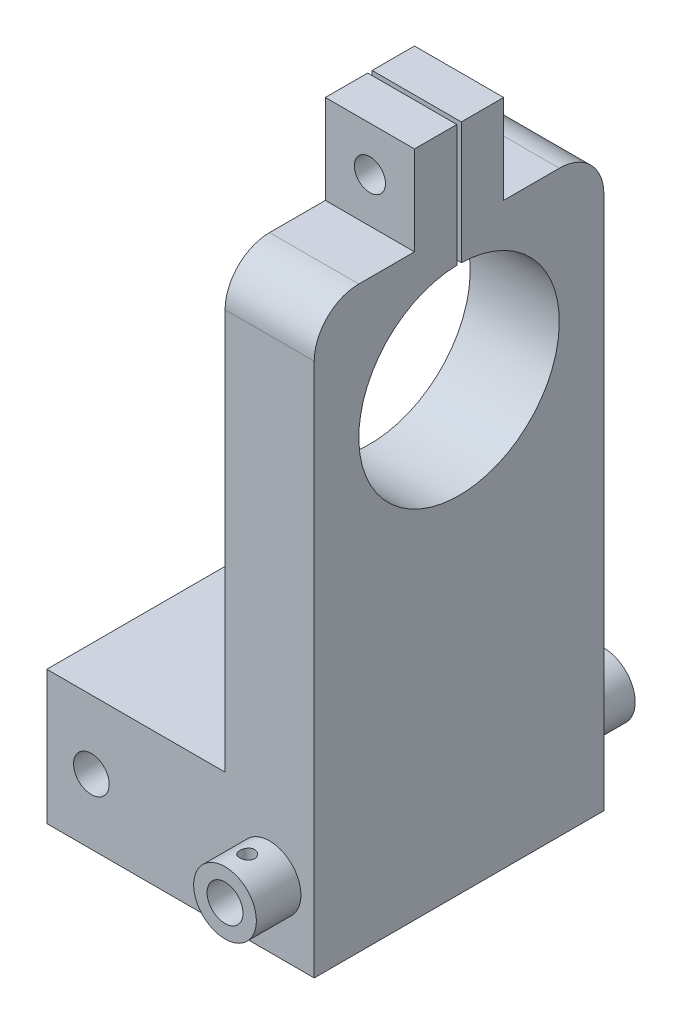
from build123d import *

# Parameters (mm, degrees)
CROQUIS1_R                                     = 22.5
SALIENTE_EXTRUIR1_DEPTH                        = 20
CROQUIS2_W                                     = 65
CROQUIS2_H                                     = 30
SALIENTE_EXTRUIR2_DEPTH                        = 40
CROQUIS4_W                                     = 1
CROQUIS4_H                                     = 60
CORTAR_EXTRUIR1_DEPTH                          = 40
TALADRO_DE_MARGEN_PARA_M61_D                   = 7
CROQUIS6_R                                     = 4
CORTAR_EXTRUIR2_DEPTH                          = 126.797456254
SALIENTE_EXTRUIR3_DEPTH                        = 10
SALIENTE_EXTRUIR3_DEPTH_BACK                   = 75
CROQUIS7_R                                     = 7.032700754
CROQUIS7_R_2                                   = 4.032700754
PERFORADOR_PARA_ROSCAR_PARA_MACHO_DE_ROS_D     = 3.3
PERFORADOR_PARA_ROSCAR_PARA_MACHO_DE_ROS_DEPTH = 5
PERFORADOR_PARA_ROSCAR_PARA_MACHO_DE_ROS_TIP   = 0.991420021
PERFORADOR_PARA_ROSCAR_PARA_MACHO_DE_2_D       = 3.3
PERFORADOR_PARA_ROSCAR_PARA_MACHO_DE_2_DEPTH   = 5
PERFORADOR_PARA_ROSCAR_PARA_MACHO_DE_2_TIP     = 0.991420021


with BuildPart() as part:
    # Croquis1 → Saliente-Extruir1 (new body)
    with BuildSketch(Plane(origin=(0, 0, 0), x_dir=(0, 0, -1), z_dir=(1, 0, 0))):
        with BuildLine():
            Line((-32.5, 0), (-32.5, -100))
            Line((-32.5, -100), (32.5, -100))
            Line((32.5, -100), (32.5, 0))
            Line((32.5, 0), (32.5, 19.863502686))
            ThreePointArc((32.5, 19.863502686), (29.571067812, 26.934570498), (22.5, 29.863502686))
            Line((22.5, 29.863502686), (10, 29.863502686))
            Line((10, 29.863502686), (10, 49.863502686))
            Line((10, 49.863502686), (-10, 49.863502686))
            Line((-10, 49.863502686), (-10, 29.863502686))
            Line((-10, 29.863502686), (-22.5, 29.863502686))
            ThreePointArc((-22.5, 29.863502686), (-29.571067812, 26.934570498), (-32.5, 19.863502686))
            Line((-32.5, 19.863502686), (-32.5, 0))
        make_face()
        Circle(CROQUIS1_R, mode=Mode.SUBTRACT)
    extrude(amount=SALIENTE_EXTRUIR1_DEPTH)

    # Croquis2 → Saliente-Extruir2 (add)
    with BuildSketch(Plane.ZY):
        with Locations((0, -85)):
            Rectangle(CROQUIS2_W, CROQUIS2_H)
    extrude(amount=SALIENTE_EXTRUIR2_DEPTH)

    # Croquis4 → Cortar-Extruir1 (cut)
    with BuildSketch(Plane.ZY):
        with Locations((0, 26.927828438)):
            Rectangle(CROQUIS4_W, CROQUIS4_H)
    extrude(amount=-CORTAR_EXTRUIR1_DEPTH, mode=Mode.SUBTRACT)

    # Taladro de margen para M61 (through all)
    with Locations(Plane(origin=(10, 39.863502686, -10), x_dir=(0, -1, 0), z_dir=(0, 0, -1))):
        with Locations((0, 0)):
            Hole(TALADRO_DE_MARGEN_PARA_M61_D / 2)

    # Croquis6 → Cortar-Extruir2 (cut, through all)
    with BuildSketch(Plane(origin=(0, 0, -32.5), x_dir=(-1, 0, 0), z_dir=(0, 0, -1))):
        with Locations((30, -85.367078143)):
            Circle(CROQUIS6_R)
        with Locations((-10, -85.367078143)):
            Circle(CROQUIS6_R)
    extrude(amount=-CORTAR_EXTRUIR2_DEPTH, mode=Mode.SUBTRACT)

    # Croquis7 → Saliente-Extruir3 (add, two sides: drawn at the far end of the back side and taken through both)
    with BuildSketch(Plane.XY.offset(32.5).offset(-SALIENTE_EXTRUIR3_DEPTH_BACK)):
        with Locations((9.986743511, -85.396971367)):
            Circle(CROQUIS7_R)
        with Locations((9.986743511, -85.396971367)):
            Circle(CROQUIS7_R_2, mode=Mode.SUBTRACT)
    extrude(amount=SALIENTE_EXTRUIR3_DEPTH + SALIENTE_EXTRUIR3_DEPTH_BACK)

    # Perforador para roscar para macho de roscar para M4x0.71
    with Locations(Plane(origin=(9.940279275, -78.364424106, 37.5), x_dir=(0.999978174306, 0.006606883628, 0), z_dir=(-0.006606883628, 0.999978174306, 0))):
        with Locations((0, 0)):
            Hole(PERFORADOR_PARA_ROSCAR_PARA_MACHO_DE_ROS_D / 2, depth=PERFORADOR_PARA_ROSCAR_PARA_MACHO_DE_ROS_DEPTH)
            with Locations((0, 0, -(PERFORADOR_PARA_ROSCAR_PARA_MACHO_DE_ROS_DEPTH + PERFORADOR_PARA_ROSCAR_PARA_MACHO_DE_ROS_TIP / 2))):  # 118° drill point
                Cone(0, PERFORADOR_PARA_ROSCAR_PARA_MACHO_DE_ROS_D / 2, PERFORADOR_PARA_ROSCAR_PARA_MACHO_DE_ROS_TIP, mode=Mode.SUBTRACT)

    # Perforador para roscar para macho de 2
    with Locations(Plane(origin=(10.118803472, -78.365510632, -37.5), x_dir=(0.999823677927, -0.018777993951, 0), z_dir=(0.018777993951, 0.999823677927, 0))):
        with Locations((0, 0)):
            Hole(PERFORADOR_PARA_ROSCAR_PARA_MACHO_DE_2_D / 2, depth=PERFORADOR_PARA_ROSCAR_PARA_MACHO_DE_2_DEPTH)
            with Locations((0, 0, -(PERFORADOR_PARA_ROSCAR_PARA_MACHO_DE_2_DEPTH + PERFORADOR_PARA_ROSCAR_PARA_MACHO_DE_2_TIP / 2))):  # 118° drill point
                Cone(0, PERFORADOR_PARA_ROSCAR_PARA_MACHO_DE_2_D / 2, PERFORADOR_PARA_ROSCAR_PARA_MACHO_DE_2_TIP, mode=Mode.SUBTRACT)


solid = part.part
